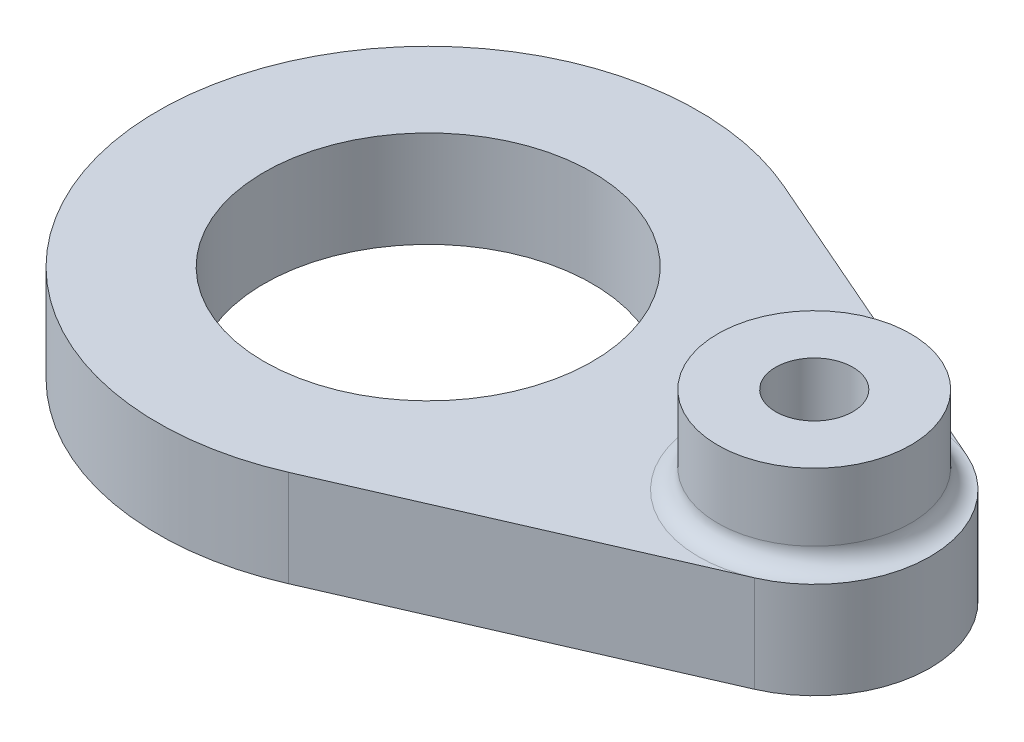
from build123d import *

# Parameters (mm, degrees)
SKETCH_1_R      = 7
SKETCH_1_R_2    = 4.2499999999999964
SKETCH_1_R_3    = 0.9999999999999998
EXTRUDE_1_DEPTH = 2.5
SKETCH_2_R      = 2.5000000000000004
SKETCH_2_R_2    = 0.9999999999999998
EXTRUDE_2_DEPTH = 2.25


with BuildPart() as part:
    # 草图1 → 凸台-拉伸1 (new body)
    # profile 1 of 2: a face of its own
    with BuildSketch(Plane(origin=(0, 0, 0), x_dir=(1, 0, 0), z_dir=(0, 1, 0))):
        Circle(SKETCH_1_R)
        with Locations(Location((0, 0, 0), (0, 0, 270))):
            Circle(SKETCH_1_R_2, mode=Mode.SUBTRACT)
    # profile 2 of 2: a face of its own
    with BuildSketch(Plane(origin=(0, 0, 0), x_dir=(1, 0, 0), z_dir=(0, 1, 0))):
        with BuildLine():
            Line((11.2, 2.749545416973503), (2.8000000000000003, 6.415605972938175))
            ThreePointArc((2.8000000000000007, 6.415605972938176), (5.856620185738529, 3.8340579025361627), (7, 0))
            ThreePointArc((7, -1.71e-15), (5.856620185738526, -3.834057902536167), (2.799999999999998, -6.4156059729381765))
            Line((2.8000000000000007, -6.415605972938176), (11.2, -2.749545416973503))
            ThreePointArc((11.2, -2.749545416973503), (13, 0), (11.2, 2.7495454169735036))
        make_face()
        with Locations(Location((10, 0, 0), (0, 0, 270))):
            Circle(SKETCH_1_R_3, mode=Mode.SUBTRACT)
    extrude(amount=EXTRUDE_1_DEPTH)

    # 草图2 → 凸台-拉伸2 (add)
    with BuildSketch(Plane(origin=(0, 2.5, 0), x_dir=(1, 0, 0), z_dir=(0, 1, 0))):
        with Locations(Location((10, 0, 0), (0, 0, 270))):
            Circle(SKETCH_2_R)
        with Locations(Location((10, 0, 0), (0, 0, 270))):
            Circle(SKETCH_2_R_2, mode=Mode.SUBTRACT)
    extrude(amount=EXTRUDE_2_DEPTH)

    # 圆角2: read off the stored shape, not the designer's step
    # 圆角2 outline → 圆角2 (revolve)
    with BuildSketch(Plane(origin=(10, 0, 0), x_dir=(1, 0, 0), z_dir=(0, 0, 1))):
        with BuildLine():
            ThreePointArc((3, 2.5), (2.646446609, 2.646446609), (2.5, 3))
            Line((2.5, 3), (2.5, 2.5))
            Line((2.5, 2.5), (3, 2.5))
        make_face()
    revolve(axis=Axis((10, 0, 0), (0, 1, 0)))


solid = part.part
